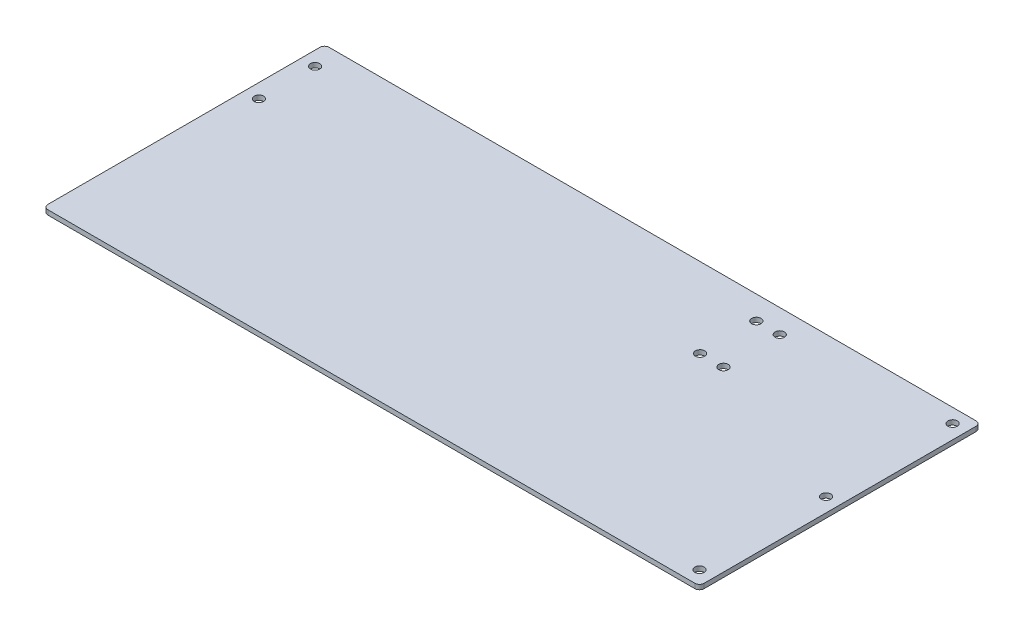
from build123d import *

# Parameters (mm, degrees)
SKETCH1_W                   = 444.5
SKETCH1_H                   = 190.5
BOSS_EXTRUDE1_DEPTH         = 3.175
F_1_4_0_25_DIAMETER_HOLE1_D = 6.35
FILLET1_R                   = 3.175
F_1_4_0_25_DIAMETER_HOLE2_D = 6.35


with BuildPart() as part:
    # Sketch1 → Boss-Extrude1 (new body)
    with BuildSketch(Plane(origin=(0, 0, 0), x_dir=(1, 0, 0), z_dir=(0, 1, 0))):
        Rectangle(SKETCH1_W, SKETCH1_H)
    extrude(amount=BOSS_EXTRUDE1_DEPTH)

    # 1/4 (0.25) Diameter Hole1 (through all)
    with Locations(Plane(origin=(0, 3.175, 0), x_dir=(1, 0, 0), z_dir=(0, 1, 0))):
        with Locations((-212.725, 79.375), (-212.725, 41.275), (101.981, 79.375), (101.981, 41.275), (86.106, 79.375), (86.106, 41.275)):
            Hole(F_1_4_0_25_DIAMETER_HOLE1_D / 2)

    # Fillet1
    fillet1_edges = [part.edges().sort_by_distance(p)[0] for p in [
        (222.25, 1.5875, -95.25),
        (222.25, 1.5875, 95.25),
        (-222.25, 1.5875, 95.25),
        (-222.25, 1.5875, -95.25),
    ]]
    fillet(fillet1_edges, radius=FILLET1_R)

    # 1/4 (0.25) Diameter Hole2 (through all)
    with Locations(Plane(origin=(0, 0, 0), x_dir=(-1, 0, 0), z_dir=(0, -1, 0))):
        with Locations((-212.725, 85.725), (-212.725, 0), (-212.725, -85.725)):
            Hole(F_1_4_0_25_DIAMETER_HOLE2_D / 2)


solid = part.part
